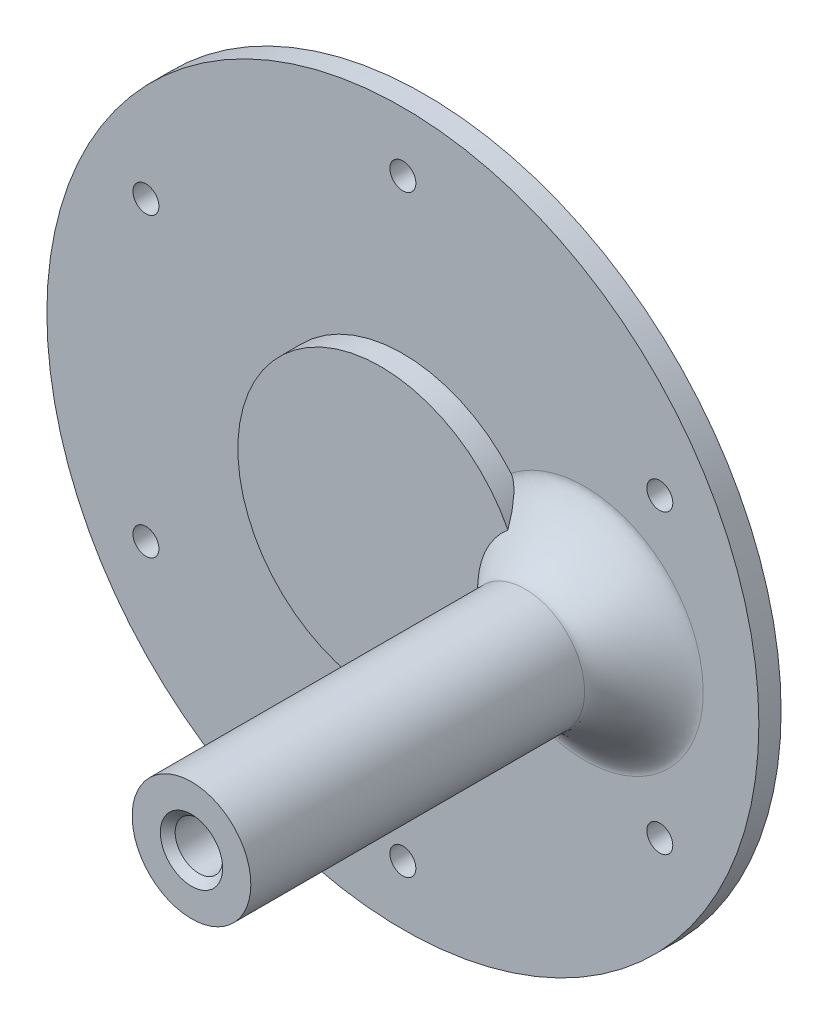
from build123d import *

# Parameters (mm, degrees)
SKETCH1_R           = 48
BOSS_EXTRUDE1_DEPTH = 3
SKETCH2_R           = 1.75
CUT_EXTRUDE1_DEPTH  = 3
CIRPATTERN1_COUNT   = 6
SKETCH3_R           = 8
BOSS_EXTRUDE2_DEPTH = 53
SKETCH4_R           = 3.2
CUT_EXTRUDE2_DEPTH  = 89
CHAMFER1_SIZE       = 1
FILLET1_SIZE        = 8
SKETCH5_R           = 19.25
BOSS_EXTRUDE3_DEPTH = 3


with BuildPart() as part:
    # Sketch1 → Boss-Extrude1 (new body)
    with BuildSketch(Plane.XY):
        Circle(SKETCH1_R)
    extrude(amount=BOSS_EXTRUDE1_DEPTH)

    # Sketch2 → Cut-Extrude1 (cut)
    with BuildSketch(Plane.XY.offset(3)):
        with Locations((0, 40)):
            Circle(SKETCH2_R)
    cut_extrude1 = extrude(amount=-CUT_EXTRUDE1_DEPTH, mode=Mode.SUBTRACT)

    # CirPattern1: Cut-Extrude1 ×6 about axis
    cirpattern1_axis = Axis((0, 0, 0), (0, 0, 1))
    for i in range(1, CIRPATTERN1_COUNT):
        add(cut_extrude1.rotate(cirpattern1_axis, i * 360 / CIRPATTERN1_COUNT), mode=Mode.SUBTRACT)

    # Sketch3 → Boss-Extrude2 (add)
    with BuildSketch(Plane.XY.offset(3)):
        with Locations((24.5, 0)):
            Circle(SKETCH3_R)
    extrude(amount=BOSS_EXTRUDE2_DEPTH)

    # Sketch4 → Cut-Extrude2 (cut, through all)
    with BuildSketch(Plane.XY.offset(56)):
        with Locations((24.5, 0)):
            Circle(SKETCH4_R)
    extrude(amount=-CUT_EXTRUDE2_DEPTH, mode=Mode.SUBTRACT)

    # Chamfer1
    chamfer1_edges = [part.edges().sort_by_distance(p)[0] for p in [
        (21.3, 0, 56),
    ]]
    chamfer(chamfer1_edges, length=CHAMFER1_SIZE)

    # Fillet1
    # a fillet whose section is not a circle: 8 mm, written as the material it adds along each edge
    with BuildSketch(Plane(origin=(24.5, 0, 3), x_dir=(1, 0, 0), z_dir=(0, -1, 0))) as fillet1_piece_1:
        with BuildLine():
            Bezier((8, FILLET1_SIZE), (8, 0), (8 + FILLET1_SIZE, 0), weights=[1, 0.25, 1])
            Line((8 + FILLET1_SIZE, 0), (8, 0))
            Line((8, 0), (8, FILLET1_SIZE))
        make_face()
    revolve(axis=Axis((24.5, 0, 3), (0, 0, 1)))

    # Sketch5 → Boss-Extrude3 (add)
    with BuildSketch(Plane.XY.offset(3)):
        Circle(SKETCH5_R)
    extrude(amount=BOSS_EXTRUDE3_DEPTH)


solid = part.part
